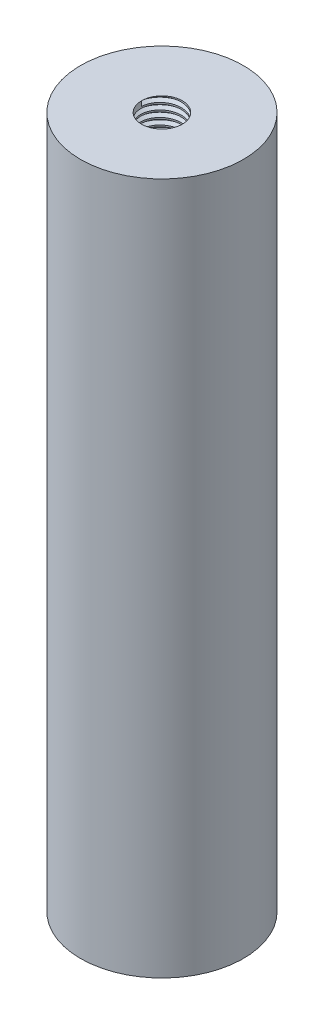
from build123d import *
from build123d.topology import SkipClean

# Parameters (mm, degrees)
SKETCH1_R           = 10
BOSS_EXTRUDE1_DEPTH = 85
SKETCH2_R           = 2.5
CUT_EXTRUDE1_DEPTH  = 20
CUT_EXTRUDE2_START  = -20
SKETCH3_R           = 2.5
CUT_EXTRUDE2_DEPTH  = 20
THREAD1_PITCH       = 0.8
THREAD2_PITCH       = 0.8


with BuildPart() as part:
    # Sketch1 → Boss-Extrude1 (new body)
    with BuildSketch(Plane(origin=(0, 0, 0), x_dir=(1, 0, 0), z_dir=(0, 1, 0))):
        with Locations(Location((0, 0, 0), (0, 0, 270))):
            Circle(SKETCH1_R)
    extrude(amount=BOSS_EXTRUDE1_DEPTH)

    # Sketch2 → Cut-Extrude1 (cut)
    with BuildSketch(Plane(origin=(0, 0, 0), x_dir=(-1, 0, 0), z_dir=(0, -1, 0))):
        with Locations(Location((0, 0, 0), (0, 0, 90))):
            Circle(SKETCH2_R)
    extrude(amount=-CUT_EXTRUDE1_DEPTH, mode=Mode.SUBTRACT)

    # Sketch3 → Cut-Extrude2 (cut)
    with BuildSketch(Plane(origin=(0, 85, 0), x_dir=(1, 0, 0), z_dir=(0, 1, 0)).offset(CUT_EXTRUDE2_START)):
        with Locations(Location((0, 0, 0), (0, 0, 90))):
            Circle(SKETCH3_R)
    extrude(amount=CUT_EXTRUDE2_DEPTH, mode=Mode.SUBTRACT)

    # Thread1: the profile of Thread Profile1 profile screwed along a right-hand helix of 25 turns, 8 arcs to a turn; built about Z, then put on its axis
    with SkipClean():  # the faces are left unmerged after this step: merging them gives an invalid solid
        thread1_z = Axis((0, 0, 0), (0, 0, 1))
        thread1_corners = [(2.4997, 0, -0.000173205), (2.9330127, 0, 0.249999999), (2.9330127, 0, 0.349999999), (2.4997, 0, 0.600173203)]
        with BuildLine(mode=Mode.PRIVATE) as thread1_profile:
            Line(thread1_corners[0], thread1_corners[1])
            Line(thread1_corners[1], thread1_corners[2])
            Line(thread1_corners[2], thread1_corners[3])
            Line(thread1_corners[3], thread1_corners[0])
        thread1_cap = Face(thread1_profile.wire())
        thread1_turn_angles = [0, 22.5, 45, 67.5, 90, 112.5, 135, 157.5, 180, 202.5, 225, 247.5, 270, 292.5, 315, 337.5, 360]
        thread1_turn_weights = [1, 0.9238795325112867, 1, 0.9238795325112867, 1, 0.9238795325112867, 1, 0.9238795325112867, 1, 0.9238795325112867, 1, 0.9238795325112867, 1, 0.9238795325112867, 1, 0.9238795325112867, 1]
        thread1_turn_rails = [Edge.make_bspline([Vector(p[0], p[1], 0).rotate(thread1_z, thread1_turn_angles[k]) / thread1_turn_weights[k] + Vector(0, 0, p[2] + THREAD1_PITCH * thread1_turn_angles[k] / 360) for k in range(17)], [0, 0, 0, 1, 1, 2, 2, 3, 3, 4, 4, 5, 5, 6, 6, 7, 7, 8, 8, 8], 2, thread1_turn_weights) for p in thread1_corners]
        thread1_turn_sides = [Face.make_surface_from_curves(thread1_turn_rails[p[0]], thread1_turn_rails[p[1]]) for p in [(0, 1), (1, 2), (2, 3), (3, 0)]]
        thread1 = Plane(origin=(0, 0, 0), x_dir=(1, 0, 0), z_dir=(0, 1, 0)) * Solid(Shell([*[p.moved(Location((0, 0, THREAD1_PITCH * i))) for i in range(25) for p in thread1_turn_sides], thread1_cap, thread1_cap.rotate(thread1_z, 9000).moved(Location((0, 0, THREAD1_PITCH * 9000 / 360)))]))
        add(thread1, mode=Mode.SUBTRACT)

    # Thread2: the profile of Thread Profile2 profile screwed along a right-hand helix of 25 turns, 8 arcs to a turn; built about Z, then put on its axis
    with SkipClean():  # the faces are left unmerged after this step: merging them gives an invalid solid
        thread2_z = Axis((0, 0, 0), (0, 0, 1))
        thread2_corners = [(2.4997, 0, -0.000173205), (2.9330127, 0, 0.249999999), (2.9330127, 0, 0.349999999), (2.4997, 0, 0.600173203)]
        with BuildLine(mode=Mode.PRIVATE) as thread2_profile:
            Line(thread2_corners[0], thread2_corners[1])
            Line(thread2_corners[1], thread2_corners[2])
            Line(thread2_corners[2], thread2_corners[3])
            Line(thread2_corners[3], thread2_corners[0])
        thread2_cap = Face(thread2_profile.wire())
        thread2_turn_angles = [0, 22.5, 45, 67.5, 90, 112.5, 135, 157.5, 180, 202.5, 225, 247.5, 270, 292.5, 315, 337.5, 360]
        thread2_turn_weights = [1, 0.9238795325112867, 1, 0.9238795325112867, 1, 0.9238795325112867, 1, 0.9238795325112867, 1, 0.9238795325112867, 1, 0.9238795325112867, 1, 0.9238795325112867, 1, 0.9238795325112867, 1]
        thread2_turn_rails = [Edge.make_bspline([Vector(p[0], p[1], 0).rotate(thread2_z, thread2_turn_angles[k]) / thread2_turn_weights[k] + Vector(0, 0, p[2] + THREAD2_PITCH * thread2_turn_angles[k] / 360) for k in range(17)], [0, 0, 0, 1, 1, 2, 2, 3, 3, 4, 4, 5, 5, 6, 6, 7, 7, 8, 8, 8], 2, thread2_turn_weights) for p in thread2_corners]
        thread2_turn_sides = [Face.make_surface_from_curves(thread2_turn_rails[p[0]], thread2_turn_rails[p[1]]) for p in [(0, 1), (1, 2), (2, 3), (3, 0)]]
        thread2 = Plane(origin=(0, 85, 0), x_dir=(-1, 0, 0), z_dir=(0, -1, 0)) * Solid(Shell([*[p.moved(Location((0, 0, THREAD2_PITCH * i))) for i in range(25) for p in thread2_turn_sides], thread2_cap, thread2_cap.rotate(thread2_z, 9000).moved(Location((0, 0, THREAD2_PITCH * 9000 / 360)))]))
        add(thread2, mode=Mode.SUBTRACT)


solid = part.part
